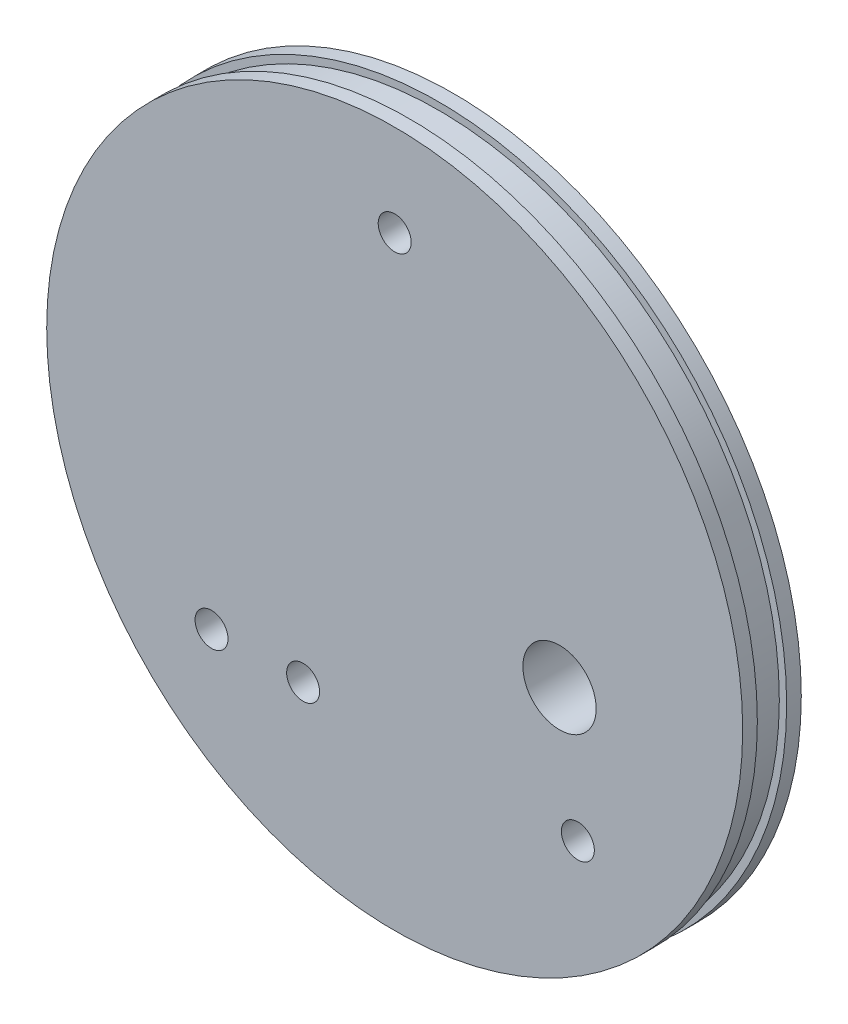
from build123d import *

# Parameters (mm, degrees)
BOSS_EXTRUDE1_DEPTH      = 8
BOSS_EXTRUDE1_DEPTH_BACK = 8
SKETCH2_R                = 95
CUT_EXTRUDE1_DEPTH       = 4
CUT_EXTRUDE1_DEPTH_BACK  = 4
SKETCH2_5_R              = 95
SKETCH2_5_R_2            = 93
SKETCH7_R                = 4.5
CUT_EXTRUDE2_DEPTH       = 167
CUT_EXTRUDE4_DEPTH       = 112
CUT_EXTRUDE4_DEPTH_BACK  = 60
SKETCH10_R               = 4.5
SKETCH11_R               = 10
CUT_EXTRUDE5_DEPTH       = 60


with BuildPart() as part:
    # Sketch2 → Boss-Extrude1 (new, two sides: drawn at the far end of the back side and taken through both)
    with BuildSketch(Plane.XY.offset(-BOSS_EXTRUDE1_DEPTH_BACK)):
        Circle(SKETCH2_R)
    extrude(amount=BOSS_EXTRUDE1_DEPTH + BOSS_EXTRUDE1_DEPTH_BACK)

    # Sketch2<5> → Cut-Extrude1 (cut, two sides: drawn at the far end of the back side and taken through both)
    with BuildSketch(Plane.XY.offset(-CUT_EXTRUDE1_DEPTH_BACK)):
        Circle(SKETCH2_5_R)
        Circle(SKETCH2_5_R_2, mode=Mode.SUBTRACT)
    extrude(amount=CUT_EXTRUDE1_DEPTH + CUT_EXTRUDE1_DEPTH_BACK, mode=Mode.SUBTRACT)

    # Sketch7 → Cut-Extrude2 (cut)
    with BuildSketch(Plane.XY.offset(8)):
        with Locations((-50, -48.75)):
            Circle(SKETCH7_R)
        with Locations((50, -48.75)):
            Circle(SKETCH7_R)
        with Locations((-25, -48.75)):
            Circle(SKETCH7_R)
    extrude(amount=-CUT_EXTRUDE2_DEPTH, mode=Mode.SUBTRACT)

    # Sketch10 → Cut-Extrude4 (cut, two sides: drawn at the far end of the back side and taken through both)
    with BuildSketch(Plane(origin=(0, 0, -8), x_dir=(-1, 0, 0), z_dir=(0, 0, -1)).offset(-CUT_EXTRUDE4_DEPTH_BACK)):
        with Locations((0, 70)):
            Circle(SKETCH10_R)
    extrude(amount=CUT_EXTRUDE4_DEPTH + CUT_EXTRUDE4_DEPTH_BACK, mode=Mode.SUBTRACT)

    # Sketch11 → Cut-Extrude5 (cut)
    with BuildSketch(Plane(origin=(0, 0, -8), x_dir=(-1, 0, 0), z_dir=(0, 0, -1))):
        with Locations((-45, -15)):
            Circle(SKETCH11_R)
    extrude(amount=-CUT_EXTRUDE5_DEPTH, mode=Mode.SUBTRACT)


solid = part.part
